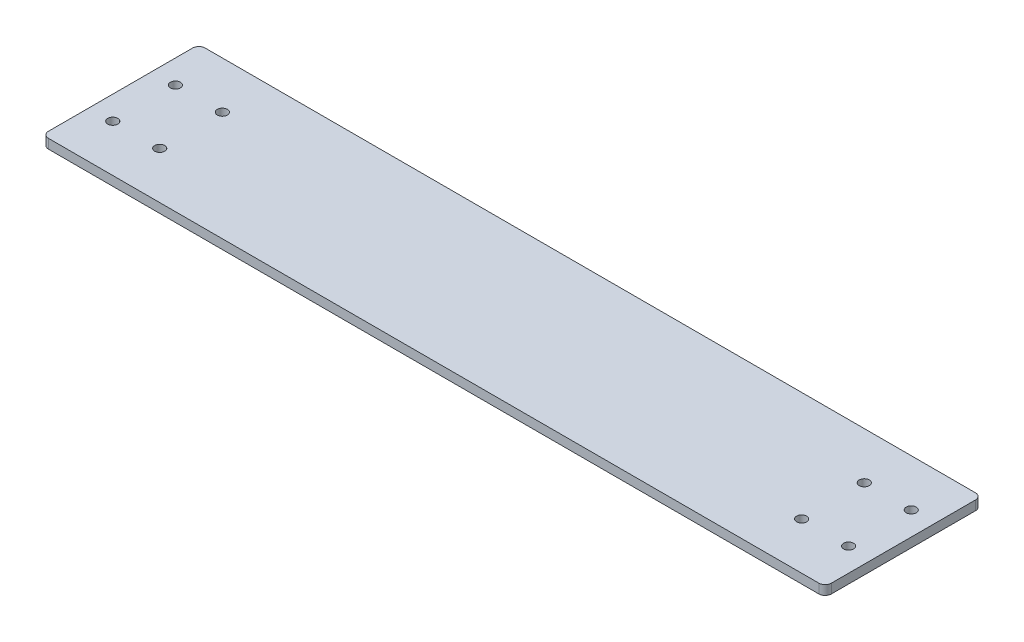
from build123d import *

# Parameters (mm, degrees)
SKETCH_1_W          = 250
SKETCH_1_H          = 50
EXTRUDE_1_DEPTH     = 3
CUT_EXTRUDE_1_REACH = 129.511
SKETCH_3_R          = 1.6
FILLET_1_R          = 2


with BuildPart() as part:
    # 草图1 → 凸台-拉伸1 (new body)
    with BuildSketch(Plane(origin=(0, 0, 0), x_dir=(1, 0, 0), z_dir=(0, 1, 0))):
        Rectangle(SKETCH_1_W, SKETCH_1_H)
    extrude(amount=EXTRUDE_1_DEPTH)

    # 草图3 → 切除-拉伸1 (cut, up to next)
    with BuildSketch(Plane(origin=(0, 3, 0), x_dir=(1, 0, 0), z_dir=(0, 1, 0)), mode=Mode.PRIVATE) as cut_extrude_1_sk1:
        with Locations((-117.5, 10)):
            Circle(SKETCH_3_R)
    cut_extrude_1_tool1 = extrude(cut_extrude_1_sk1.sketch, amount=-CUT_EXTRUDE_1_REACH, mode=Mode.PRIVATE) & part.part
    # 草图3 → 切除-拉伸1 (cut, up to next)
    with BuildSketch(Plane(origin=(0, 3, 0), x_dir=(1, 0, 0), z_dir=(0, 1, 0)), mode=Mode.PRIVATE) as cut_extrude_1_sk2:
        with Locations((-102.5, 10)):
            Circle(SKETCH_3_R)
    cut_extrude_1_tool2 = extrude(cut_extrude_1_sk2.sketch, amount=-CUT_EXTRUDE_1_REACH, mode=Mode.PRIVATE) & part.part
    # 草图3 → 切除-拉伸1 (cut, up to next)
    with BuildSketch(Plane(origin=(0, 3, 0), x_dir=(1, 0, 0), z_dir=(0, 1, 0)), mode=Mode.PRIVATE) as cut_extrude_1_sk3:
        with Locations((-102.5, -10)):
            Circle(SKETCH_3_R)
    cut_extrude_1_tool3 = extrude(cut_extrude_1_sk3.sketch, amount=-CUT_EXTRUDE_1_REACH, mode=Mode.PRIVATE) & part.part
    # 草图3 → 切除-拉伸1 (cut, up to next)
    with BuildSketch(Plane(origin=(0, 3, 0), x_dir=(1, 0, 0), z_dir=(0, 1, 0)), mode=Mode.PRIVATE) as cut_extrude_1_sk4:
        with Locations((-117.5, -10)):
            Circle(SKETCH_3_R)
    cut_extrude_1_tool4 = extrude(cut_extrude_1_sk4.sketch, amount=-CUT_EXTRUDE_1_REACH, mode=Mode.PRIVATE) & part.part
    # 草图3 → 切除-拉伸1 (cut, up to next)
    with BuildSketch(Plane(origin=(0, 3, 0), x_dir=(1, 0, 0), z_dir=(0, 1, 0)), mode=Mode.PRIVATE) as cut_extrude_1_sk5:
        with Locations((117.5, -10)):
            Circle(SKETCH_3_R)
    cut_extrude_1_tool5 = extrude(cut_extrude_1_sk5.sketch, amount=-CUT_EXTRUDE_1_REACH, mode=Mode.PRIVATE) & part.part
    # 草图3 → 切除-拉伸1 (cut, up to next)
    with BuildSketch(Plane(origin=(0, 3, 0), x_dir=(1, 0, 0), z_dir=(0, 1, 0)), mode=Mode.PRIVATE) as cut_extrude_1_sk6:
        with Locations((102.5, 10)):
            Circle(SKETCH_3_R)
    cut_extrude_1_tool6 = extrude(cut_extrude_1_sk6.sketch, amount=-CUT_EXTRUDE_1_REACH, mode=Mode.PRIVATE) & part.part
    # 草图3 → 切除-拉伸1 (cut, up to next)
    with BuildSketch(Plane(origin=(0, 3, 0), x_dir=(1, 0, 0), z_dir=(0, 1, 0)), mode=Mode.PRIVATE) as cut_extrude_1_sk7:
        with Locations((117.5, 10)):
            Circle(SKETCH_3_R)
    cut_extrude_1_tool7 = extrude(cut_extrude_1_sk7.sketch, amount=-CUT_EXTRUDE_1_REACH, mode=Mode.PRIVATE) & part.part
    # 草图3 → 切除-拉伸1 (cut, up to next)
    with BuildSketch(Plane(origin=(0, 3, 0), x_dir=(1, 0, 0), z_dir=(0, 1, 0)), mode=Mode.PRIVATE) as cut_extrude_1_sk8:
        with Locations((102.5, -10)):
            Circle(SKETCH_3_R)
    cut_extrude_1_tool8 = extrude(cut_extrude_1_sk8.sketch, amount=-CUT_EXTRUDE_1_REACH, mode=Mode.PRIVATE) & part.part
    add(cut_extrude_1_tool1.solids().sort_by_distance((-117.5, 3, -10))[0], mode=Mode.SUBTRACT)
    add(cut_extrude_1_tool2.solids().sort_by_distance((-102.5, 3, -10))[0], mode=Mode.SUBTRACT)
    add(cut_extrude_1_tool3.solids().sort_by_distance((-102.5, 3, 10))[0], mode=Mode.SUBTRACT)
    add(cut_extrude_1_tool4.solids().sort_by_distance((-117.5, 3, 10))[0], mode=Mode.SUBTRACT)
    add(cut_extrude_1_tool5.solids().sort_by_distance((117.5, 3, 10))[0], mode=Mode.SUBTRACT)
    add(cut_extrude_1_tool6.solids().sort_by_distance((102.5, 3, -10))[0], mode=Mode.SUBTRACT)
    add(cut_extrude_1_tool7.solids().sort_by_distance((117.5, 3, -10))[0], mode=Mode.SUBTRACT)
    add(cut_extrude_1_tool8.solids().sort_by_distance((102.5, 3, 10))[0], mode=Mode.SUBTRACT)

    # 圆角1
    fillet_1_edges = [part.edges().sort_by_distance(p)[0] for p in [
        (125, 1.5, -25),
        (125, 1.5, 25),
        (-125, 1.5, 25),
        (-125, 1.5, -25),
    ]]
    fillet(fillet_1_edges, radius=FILLET_1_R)


solid = part.part
